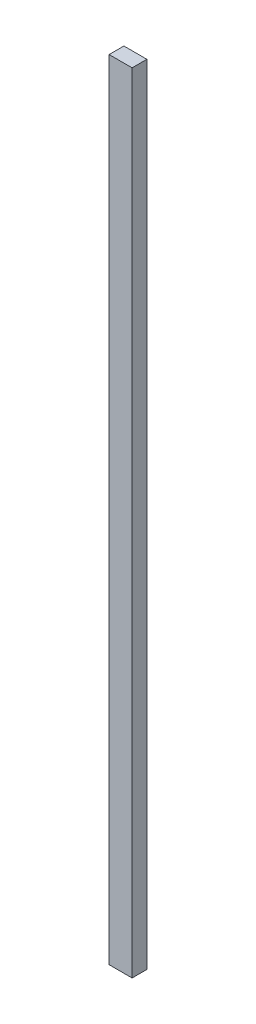
from build123d import *

# Parameters (mm, degrees)
SKETCH1_W   = 70
SKETCH1_H   = 45
SHAPE_DEPTH = 2400


with BuildPart() as part:
    # Sketch1 → Shape (new body)
    with BuildSketch(Plane(origin=(0, 0, 0), x_dir=(1, 0, 0), z_dir=(0, 1, 0))):
        Rectangle(SKETCH1_W, SKETCH1_H)
    extrude(amount=SHAPE_DEPTH)


solid = part.part
